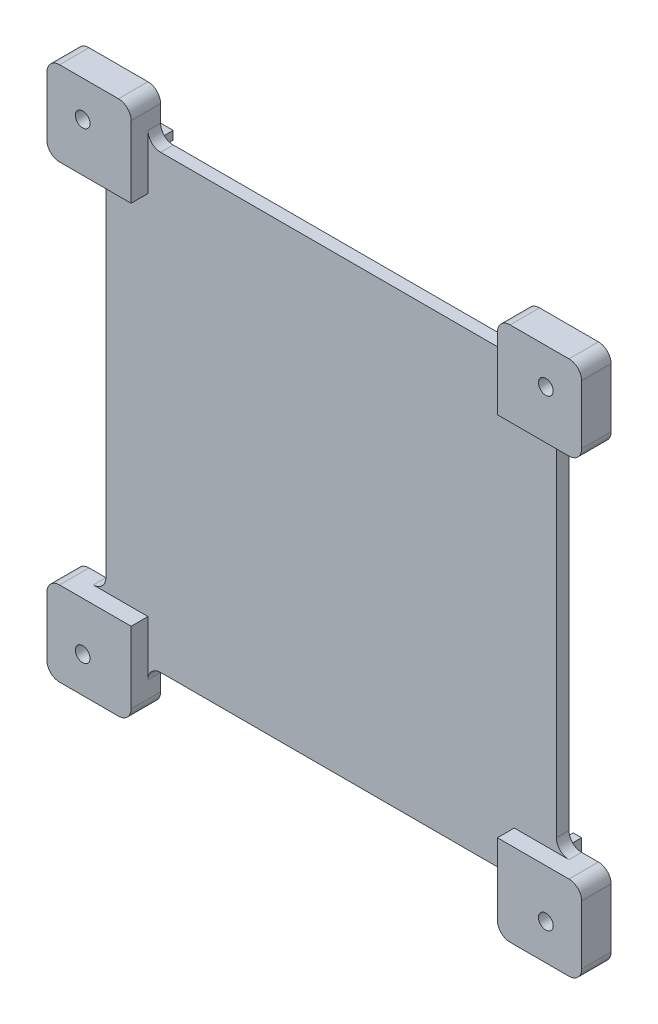
from build123d import *

# Parameters (mm, degrees)
SKETCH1_W               = 107
SKETCH1_H               = 107
BOSS_EXTRUDE1_DEPTH     = 6
SHELL6_T                = -2
CUT_EXTRUDE1_DEPTH      = 151.03332963
CUT_EXTRUDE1_DEPTH_BACK = 105
SKETCH2_W               = 89
SKETCH2_H               = 3
CUT_EXTRUDE2_DEPTH      = 152.439756999
CUT_EXTRUDE2_DEPTH_BACK = 152.439756999
SKETCH3_W               = 4.823716506
SKETCH3_H               = 87
SKETCH4_R               = 1.75
BOSS_EXTRUDE2_DEPTH     = 7
BOSS_EXTRUDE3_START     = 3
SKETCH5_R               = 1.75
BOSS_EXTRUDE3_DEPTH     = 3
SKETCH6_W               = 127
SKETCH6_H               = 127
CUT_EXTRUDE3_DEPTH      = 3
FILLET2_R               = 3


with BuildPart() as part:
    # Sketch1 → Boss-Extrude1 (new body)
    with BuildSketch(Plane.XY):
        with Locations((53.5, 53.5)):
            Rectangle(SKETCH1_W, SKETCH1_H)
    extrude(amount=BOSS_EXTRUDE1_DEPTH)

    # Shell6
    shell6_openings = [part.faces().sort_by_distance(p)[0] for p in [
        (53.5, 53.5, 0),
    ]]
    offset(amount=SHELL6_T, openings=shell6_openings, kind=Kind.INTERSECTION)

    # Sketch2 → Cut-Extrude1 (cut, two sides: drawn at the far end of the back side and taken through both)
    with BuildSketch(Plane.XZ.offset(-105).offset(-CUT_EXTRUDE1_DEPTH_BACK)):
        with Locations((54.5, 1.5)):
            Rectangle(SKETCH2_W, SKETCH2_H)
    extrude(amount=CUT_EXTRUDE1_DEPTH + CUT_EXTRUDE1_DEPTH_BACK, mode=Mode.SUBTRACT)

    # Sketch3 → Cut-Extrude2 (cut, two sides: drawn at the far end of the back side and taken through both)
    with BuildSketch(Plane(origin=(107, 0, 0), x_dir=(0, 0, -1), z_dir=(1, 0, 0)).offset(-CUT_EXTRUDE2_DEPTH_BACK)):
        with Locations((-0.588141747, 53.5)):
            Rectangle(SKETCH3_W, SKETCH3_H)
    extrude(amount=CUT_EXTRUDE2_DEPTH + CUT_EXTRUDE2_DEPTH_BACK, mode=Mode.SUBTRACT)

    # Sketch4 → Boss-Extrude2 (add)
    # profile 1 of 4: a face of its own
    with BuildSketch(Plane.XY.offset(6)):
        Polygon((10, 107), (10, 97), (-10, 97), (-10, 117), (10, 117), align=None)
        with Locations((-1.5, 108.5)):
            Circle(SKETCH4_R, mode=Mode.SUBTRACT)
    # profile 2 of 4: a face of its own
    with BuildSketch(Plane.XY.offset(6)):
        Polygon((97, 97), (117, 97), (117, 117), (97, 117), (97, 107), align=None)
        with Locations(Location((108.5, 108.5, 0), (0, 0, 180))):
            Circle(SKETCH4_R, mode=Mode.SUBTRACT)
    # profile 3 of 4: a face of its own
    with BuildSketch(Plane.XY.offset(6)):
        Polygon((117, -10), (97, -10), (97, 0), (97, 10), (117, 10), align=None)
        with Locations((108.5, -1.5)):
            Circle(SKETCH4_R, mode=Mode.SUBTRACT)
    # profile 4 of 4: a face of its own
    with BuildSketch(Plane.XY.offset(6)):
        Polygon((10, 0), (10, 10), (-10, 10), (-10, -10), (10, -10), align=None)
        with Locations(Location((-1.5, -1.5, 0), (0, 0, 180))):
            Circle(SKETCH4_R, mode=Mode.SUBTRACT)
    extrude(amount=BOSS_EXTRUDE2_DEPTH)

    # Sketch5 → Boss-Extrude3 (add)
    # profile 1 of 4: a face of its own
    with BuildSketch(Plane(origin=(0, 0, 6), x_dir=(-1, 0, 0), z_dir=(0, 0, -1)).offset(BOSS_EXTRUDE3_START)):
        Polygon((-107, 97), (-117, 97), (-117, 117), (-97, 117), (-97, 107), (-107, 107), align=None)
        with Locations((-108.5, 108.5)):
            Circle(SKETCH5_R, mode=Mode.SUBTRACT)
    # profile 2 of 4: a face of its own
    with BuildSketch(Plane(origin=(0, 0, 6), x_dir=(-1, 0, 0), z_dir=(0, 0, -1)).offset(BOSS_EXTRUDE3_START)):
        Polygon((10, 97), (10, 117), (-10, 117), (-10, 107), (0, 107), (0, 97), align=None)
        with Locations(Location((1.5, 108.5, 0), (0, 0, 180))):
            Circle(SKETCH5_R, mode=Mode.SUBTRACT)
    # profile 3 of 4: a face of its own
    with BuildSketch(Plane(origin=(0, 0, 6), x_dir=(-1, 0, 0), z_dir=(0, 0, -1)).offset(BOSS_EXTRUDE3_START)):
        Polygon((10, 10), (10, -10), (-10, -10), (-10, 0), (0, 0), (0, 10), align=None)
        with Locations((1.5, -1.5)):
            Circle(SKETCH5_R, mode=Mode.SUBTRACT)
    # profile 4 of 4: a face of its own
    with BuildSketch(Plane(origin=(0, 0, 6), x_dir=(-1, 0, 0), z_dir=(0, 0, -1)).offset(BOSS_EXTRUDE3_START)):
        Polygon((-117, 10), (-117, -10), (-97, -10), (-97, 0), (-107, 0), (-107, 10), align=None)
        with Locations(Location((-108.5, -1.5, 0), (0, 0, 180))):
            Circle(SKETCH5_R, mode=Mode.SUBTRACT)
    extrude(amount=-BOSS_EXTRUDE3_DEPTH)

    # Sketch6 → Cut-Extrude3 (cut)
    with BuildSketch(Plane.XY.offset(13)):
        with Locations((53.5, 53.5)):
            Rectangle(SKETCH6_W, SKETCH6_H)
    extrude(amount=-CUT_EXTRUDE3_DEPTH, mode=Mode.SUBTRACT)

    # Fillet2
    # the kernel refuses this fillet: 3 mm, written as the material it adds along each edge
    with BuildSketch(Plane(origin=(107, 97, 3), x_dir=(0, -1, 0), z_dir=(0, 0, 1)), Plane(origin=(0, 97, 3), x_dir=(-1, 0, 0), z_dir=(0, 0, 1)), Plane(origin=(10, 107, 3), x_dir=(1, 0, 0), z_dir=(0, 0, 1)), Plane(origin=(0, 10, 3), x_dir=(0, 1, 0), z_dir=(0, 0, 1)), Plane(origin=(107, 10, 3), x_dir=(1, 0, 0), z_dir=(0, 0, 1)), Plane(origin=(97, 0, 3), x_dir=(-1, 0, 0), z_dir=(0, 0, 1))) as fillet2_piece_1:
        with BuildLine():
            CenterArc((FILLET2_R, FILLET2_R), FILLET2_R, 180, 90)
            Line((0, FILLET2_R), (0, 0))
            Line((0, 0), (FILLET2_R, 0))
        make_face()
    extrude(amount=3)
    with BuildSketch(Plane(origin=(97, 107, 3), x_dir=(-1, 0, 0), z_dir=(0, 0, 1)), Plane(origin=(10, 0, 3), x_dir=(1, 0, 0), z_dir=(0, 0, 1))) as fillet2_piece_2:
        with BuildLine():
            CenterArc((FILLET2_R, -FILLET2_R), FILLET2_R, 90, 90)
            Line((0, -FILLET2_R), (0, 0))
            Line((0, 0), (FILLET2_R, 0))
        make_face()
    extrude(amount=3)
    # the kernel refuses this fillet: 3 mm, written as the material it takes off along each edge
    with BuildSketch(Plane(origin=(-10, -10, -4.5), x_dir=(1, 0, 0), z_dir=(0, 0, 1)), Plane(origin=(10, -10, -4.5), x_dir=(0, 1, 0), z_dir=(0, 0, 1)), Plane(origin=(-10, 10, 17.5), x_dir=(1, 0, 0), z_dir=(0, 0, -1)), Plane(origin=(97, -10, -4.5), x_dir=(1, 0, 0), z_dir=(0, 0, 1)), Plane(origin=(117, -10, -4.5), x_dir=(0, 1, 0), z_dir=(0, 0, 1)), Plane(origin=(117, 10, -4.5), x_dir=(-1, 0, 0), z_dir=(0, 0, 1)), Plane(origin=(117, 97, -4.5), x_dir=(0, 1, 0), z_dir=(0, 0, 1)), Plane(origin=(10, 117, -4.5), x_dir=(-1, 0, 0), z_dir=(0, 0, 1))) as fillet2_2_piece_1:
        with BuildLine():
            CenterArc((FILLET2_R, FILLET2_R), FILLET2_R, 180, 90)
            Line((0, FILLET2_R), (0, 0))
            Line((0, 0), (FILLET2_R, 0))
        make_face()
    extrude(amount=22, mode=Mode.SUBTRACT)
    with BuildSketch(Plane(origin=(97, 117, 17.5), x_dir=(0, -1, 0), z_dir=(0, 0, -1)), Plane(origin=(117, 117, 17.5), x_dir=(-1, 0, 0), z_dir=(0, 0, -1)), Plane(origin=(-10, 97, 17.5), x_dir=(1, 0, 0), z_dir=(0, 0, -1)), Plane(origin=(-10, 117, 17.5), x_dir=(0, -1, 0), z_dir=(0, 0, -1))) as fillet2_2_piece_2:
        with BuildLine():
            CenterArc((FILLET2_R, -FILLET2_R), FILLET2_R, 90, 90)
            Line((0, -FILLET2_R), (0, 0))
            Line((0, 0), (FILLET2_R, 0))
        make_face()
    extrude(amount=22, mode=Mode.SUBTRACT)


solid = part.part
